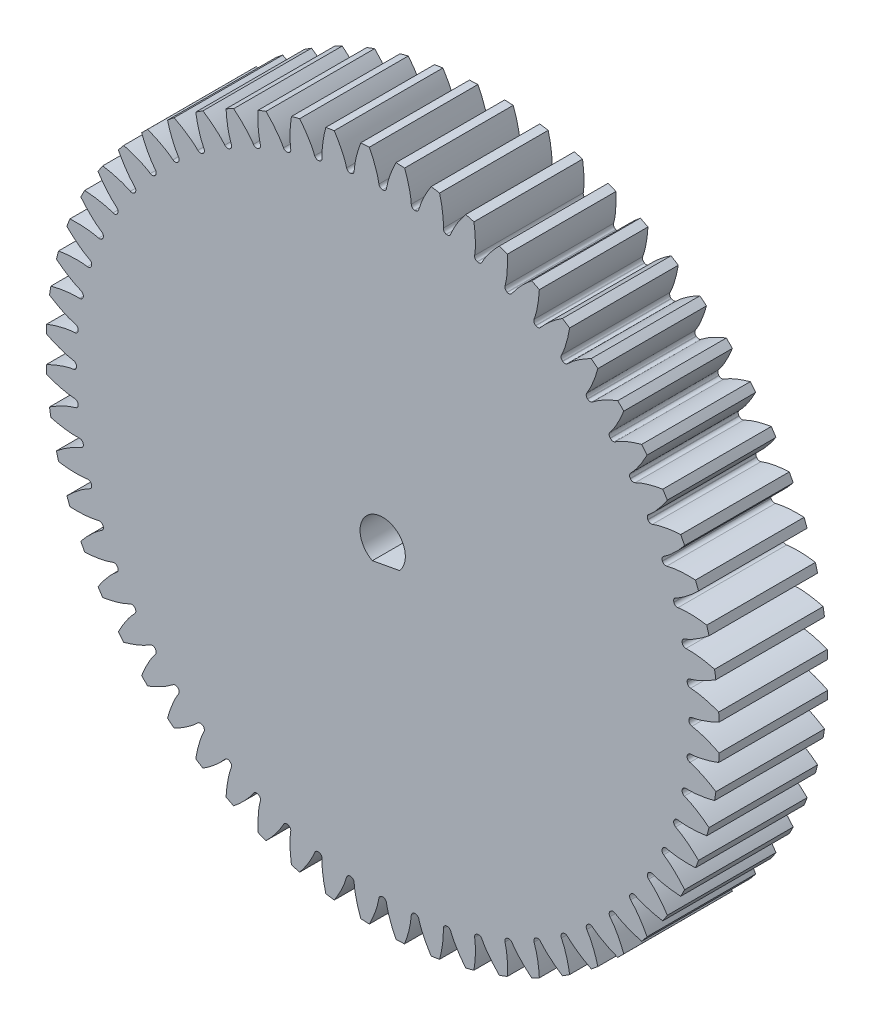
from build123d import *

# Parameters (mm, degrees)
BOSS_EXTRUDE1_DEPTH      = 6.35
BOSS_EXTRUDE1_DEPTH_BACK = 6.35
SKETCH3_R                = 39.37
CUT_EXTRUDE1_DEPTH       = 57.038525141
FILLET1_R                = 0.426091396
CIRPATTERN1_COUNT        = 60
FILLET1_OF_CIRPATTERN1_R = 0.426091396
CUT_EXTRUDE2_DEPTH       = 58.064905917


with BuildPart() as part:
    # Sketch3 → Boss-Extrude1 (new, two sides: drawn at the far end of the back side and taken through both)
    with BuildSketch(Plane.XY.offset(-BOSS_EXTRUDE1_DEPTH_BACK)):
        Circle(SKETCH3_R)
    extrude(amount=BOSS_EXTRUDE1_DEPTH + BOSS_EXTRUDE1_DEPTH_BACK)

    # Sketch4 → Cut-Extrude1 (cut, symmetric)
    with BuildSketch(Plane.XY):
        with BuildLine():
            ThreePointArc((35.799885966, 0.403680688), (35.802161852, 0), (35.800012958, -0.40368212))
            add(Edge.make_bspline(
                [(35.800012958, -0.40368212), (35.805550083, -0.40379815), (35.821078422, -0.404289585), (35.850427925, -0.405874271), (35.898308477, -0.409391603), (35.959299372, -0.415243091), (36.038110217, -0.424380068), (36.130920387, -0.437168956), (36.232881612, -0.453346853), (36.343769522, -0.473241075), (36.454355504, -0.495117666), (36.56462854, -0.518831001), (36.674436723, -0.544158927), (36.807396341, -0.576856884), (36.966749902, -0.618870182), (37.152885261, -0.672070042), (37.363834604, -0.737239862), (37.578651296, -0.808836317), (37.789880551, -0.883543476), (38.003116718, -0.963928396), (38.209304019, -1.045179017), (38.423274879, -1.134608426), (38.620680309, -1.21971488), (38.841622259, -1.320648819), (39.019858567, -1.403731936), (39.203784748, -1.494221571), (39.293274658, -1.538952316), (39.33899763, -1.562102909)],
                knots=[0, 0, 0, 0, 0, 0.005376749, 0.015083688, 0.02853182, 0.04661014, 0.06485485, 0.092110526, 0.119476176, 0.146842496, 0.174208854, 0.201574956, 0.228941013, 0.256307345, 0.307035032, 0.361767352, 0.416499661, 0.471231937, 0.525964282, 0.580696616, 0.635428982, 0.690161387, 0.744893688, 0.799626082, 0.854358407, 0.909090914, 0.909090914, 0.909090914, 0.909090914, 0.909090914], degree=4))
            ThreePointArc((39.33899763, -1.562102909), (39.37, 0), (39.33899763, 1.562102909))
            add(Edge.make_bspline(
                [(35.799885966, 0.403680688), (35.805550083, 0.40379815), (35.821078422, 0.404289585), (35.850427925, 0.405874271), (35.898308477, 0.409391603), (35.959299372, 0.415243091), (36.038110217, 0.424380068), (36.130920387, 0.437168956), (36.232881612, 0.453346853), (36.343769522, 0.473241075), (36.454355504, 0.495117666), (36.56462854, 0.518831001), (36.674436723, 0.544158927), (36.807396341, 0.576856884), (36.966749902, 0.618870182), (37.152885261, 0.672070042), (37.363834604, 0.737239862), (37.578651296, 0.808836317), (37.789880551, 0.883543476), (38.003116718, 0.963928396), (38.209304019, 1.045179017), (38.423274879, 1.134608426), (38.620680309, 1.21971488), (38.841622259, 1.320648819), (39.019858567, 1.403731936), (39.203784748, 1.494221571), (39.293274658, 1.538952316), (39.33899763, 1.562102909)],
                knots=[0, 0, 0, 0, 0, 0.005376749, 0.015083688, 0.02853182, 0.04661014, 0.06485485, 0.092110526, 0.119476176, 0.146842496, 0.174208854, 0.201574956, 0.228941013, 0.256307345, 0.307035032, 0.361767352, 0.416499661, 0.471231937, 0.525964282, 0.580696616, 0.635428982, 0.690161387, 0.744893688, 0.799626082, 0.854358407, 0.909090914, 0.909090914, 0.909090914, 0.909090914, 0.909090914], degree=4))
        make_face()
    cut_extrude1 = extrude(amount=CUT_EXTRUDE1_DEPTH, both=True, mode=Mode.SUBTRACT)

    # Fillet1
    fillet1_edges = [part.edges().sort_by_distance(p)[0] for p in [
        (35.800012958, -0.40368212, 3.175),
        (35.799885966, 0.403680688, 3.175),
    ]]
    fillet(fillet1_edges, radius=FILLET1_R)

    # CirPattern1: Cut-Extrude1 ×60 about axis
    cirpattern1_axis = Axis((0, 0, 6.35), (0, 0, -1))
    for i in range(1, CIRPATTERN1_COUNT):
        add(cut_extrude1.rotate(cirpattern1_axis, i * 360 / CIRPATTERN1_COUNT), mode=Mode.SUBTRACT)

    # Fillet1 of CirPattern1
    fillet1_of_cirpattern1_edges = [part.edges().sort_by_distance(p)[0] for p in [
        (35.561700469, -4.143591046, 3.175),
        (35.645966567, -3.340637782, 3.175),
        (34.933766549, -7.838101922, 3.175),
        (35.101502499, -7.048355526, 3.175),
        (33.923090972, -11.446736913, 3.175),
        (34.172459023, -10.678850011, 3.175),
        (32.540746911, -14.92995906, 3.175),
        (32.869014936, -14.192344781, 3.175),
        (30.801879617, -18.24960545, 3.175),
        (31.205451043, -17.550345252, 3.175),
        (28.725540485, -21.369305344, 3.175),
        (29.199993698, -20.716060468, 3.175),
        (26.33447832, -24.254878657, 3.175),
        (26.874615112, -23.65480619, 3.175),
        (23.6548901, -26.874710443, 3.175),
        (24.254792618, -26.334384905, 3.175),
        (20.716133953, -29.200097278, 3.175),
        (21.369229541, -28.725438588, 3.175),
        (17.550407508, -31.205561737, 3.175),
        (18.249540714, -30.801770355, 3.175),
        (14.192395126, -32.869131532, 3.175),
        (14.929906099, -32.54063148, 3.175),
        (10.678887892, -34.172580242, 3.175),
        (11.446696309, -33.922970638, 3.175),
        (7.048380528, -35.101627013, 3.175),
        (7.838074119, -34.93364263, 3.175),
        (3.340649632, -35.646093013, 3.175),
        (4.143576348, -35.561574323, 3.175),
        (-0.40368212, -35.800012958, 3.175),
        (0.403680688, -35.799885966, 3.175),
        (-4.143591046, -35.561700469, 3.175),
        (-3.340637782, -35.645966567, 3.175),
        (-7.838101922, -34.933766549, 3.175),
        (-7.048355526, -35.101502499, 3.175),
        (-11.446736913, -33.923090972, 3.175),
        (-10.678850011, -34.172459023, 3.175),
        (-14.92995906, -32.540746911, 3.175),
        (-14.192344781, -32.869014936, 3.175),
        (-18.24960545, -30.801879617, 3.175),
        (-17.550345252, -31.205451043, 3.175),
        (-21.369305344, -28.725540485, 3.175),
        (-20.716060468, -29.199993698, 3.175),
        (-24.254878657, -26.33447832, 3.175),
        (-23.65480619, -26.874615112, 3.175),
        (-26.874710443, -23.6548901, 3.175),
        (-26.334384905, -24.254792618, 3.175),
        (-29.200097278, -20.716133953, 3.175),
        (-28.725438588, -21.369229541, 3.175),
        (-31.205561737, -17.550407508, 3.175),
        (-30.801770355, -18.249540714, 3.175),
        (-32.869131532, -14.192395126, 3.175),
        (-32.54063148, -14.929906099, 3.175),
        (-34.172580242, -10.678887892, 3.175),
        (-33.922970638, -11.446696309, 3.175),
        (-35.101627013, -7.048380528, 3.175),
        (-34.93364263, -7.838074119, 3.175),
        (-35.646093013, -3.340649632, 3.175),
        (-35.561574323, -4.143576348, 3.175),
        (-35.800012958, 0.40368212, 3.175),
        (-35.799885966, -0.403680688, 3.175),
        (-35.561700469, 4.143591046, 3.175),
        (-35.645966567, 3.340637782, 3.175),
        (-34.933766549, 7.838101922, 3.175),
        (-35.101502499, 7.048355526, 3.175),
        (-33.923090972, 11.446736913, 3.175),
        (-34.172459023, 10.678850011, 3.175),
        (-32.540746911, 14.92995906, 3.175),
        (-32.869014936, 14.192344781, 3.175),
        (-30.801879617, 18.24960545, 3.175),
        (-31.205451043, 17.550345252, 3.175),
        (-28.725540485, 21.369305344, 3.175),
        (-29.199993698, 20.716060468, 3.175),
        (-26.33447832, 24.254878657, 3.175),
        (-26.874615112, 23.65480619, 3.175),
        (-23.6548901, 26.874710443, 3.175),
        (-24.254792618, 26.334384905, 3.175),
        (-20.716133953, 29.200097278, 3.175),
        (-21.369229541, 28.725438588, 3.175),
        (-17.550407508, 31.205561737, 3.175),
        (-18.249540714, 30.801770355, 3.175),
        (-14.192395126, 32.869131532, 3.175),
        (-14.929906099, 32.54063148, 3.175),
        (-10.678887892, 34.172580242, 3.175),
        (-11.446696309, 33.922970638, 3.175),
        (-7.048380528, 35.101627013, 3.175),
        (-7.838074119, 34.93364263, 3.175),
        (-3.340649632, 35.646093013, 3.175),
        (-4.143576348, 35.561574323, 3.175),
        (0.40368212, 35.800012958, 3.175),
        (-0.403680688, 35.799885966, 3.175),
        (4.143591046, 35.561700469, 3.175),
        (3.340637782, 35.645966567, 3.175),
        (7.838101922, 34.933766549, 3.175),
        (7.048355526, 35.101502499, 3.175),
        (11.446736913, 33.923090972, 3.175),
        (10.678850011, 34.172459023, 3.175),
        (14.92995906, 32.540746911, 3.175),
        (14.192344781, 32.869014936, 3.175),
        (18.24960545, 30.801879617, 3.175),
        (17.550345252, 31.205451043, 3.175),
        (21.369305344, 28.725540485, 3.175),
        (20.716060468, 29.199993698, 3.175),
        (24.254878657, 26.33447832, 3.175),
        (23.65480619, 26.874615112, 3.175),
        (26.874710443, 23.6548901, 3.175),
        (26.334384905, 24.254792618, 3.175),
        (29.200097278, 20.716133953, 3.175),
        (28.725438588, 21.369229541, 3.175),
        (31.205561737, 17.550407508, 3.175),
        (30.801770355, 18.249540714, 3.175),
        (32.869131532, 14.192395126, 3.175),
        (32.54063148, 14.929906099, 3.175),
        (34.172580242, 10.678887892, 3.175),
        (33.922970638, 11.446696309, 3.175),
        (35.101627013, 7.048380528, 3.175),
        (34.93364263, 7.838074119, 3.175),
        (35.646093013, 3.340649632, 3.175),
        (35.561574323, 4.143576348, 3.175),
    ]]
    fillet(fillet1_of_cirpattern1_edges, radius=FILLET1_OF_CIRPATTERN1_R)

    # Sketch6 → Cut-Extrude2 (cut, through all)
    with BuildSketch(Plane.XY.offset(6.35)):
        with BuildLine():
            ThreePointArc((2.65, 0), (-1.382830314, 2.260592914), (-1.206815339, -2.359257667))
            Line((-1.206815339, -2.359257667), (1.971762693, -1.770494813))
            ThreePointArc((1.971762693, -1.770494813), (2.474638472, -0.947979131), (2.65, 0))
        make_face()
    extrude(amount=-CUT_EXTRUDE2_DEPTH, mode=Mode.SUBTRACT)


solid = part.part
